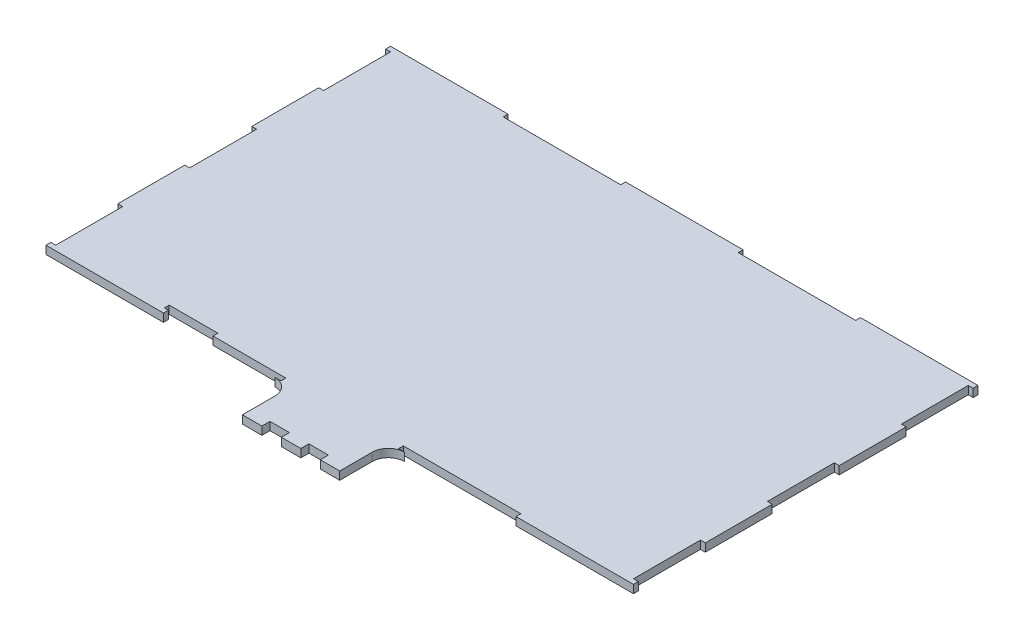
from build123d import *

# Parameters (mm, degrees)
BOSS_EXTRUDE1_DEPTH = 5


with BuildPart() as part:
    # Sketch1 → Boss-Extrude1 (new body)
    with BuildSketch(Plane(origin=(0, 0, 0), x_dir=(1, 0, 0), z_dir=(0, 1, 0))):
        with BuildLine():
            Line((-30.000015974, -136.250310986), (-18.000015974, -136.250310986))
            Line((-18.000015974, -136.250310986), (-18.000015974, -131.250310986))
            Line((-18.000015974, -131.250310986), (-6.000015974, -131.250310986))
            Line((-6.000015974, -131.250310986), (-6.000015974, -136.250310986))
            Line((-6.000015974, -136.250310986), (5.999984026, -136.250310986))
            Line((5.999984026, -136.250310986), (5.999984026, -131.250310986))
            Line((5.999984026, -131.250310986), (17.999984026, -131.250310986))
            Line((17.999984026, -131.250310986), (17.999984026, -136.250310986))
            Line((17.999984026, -136.250310986), (30.000006721, -136.250310986))
            Line((30.000006721, -136.250310986), (30.000006721, -116.24999063))
            ThreePointArc((30.000006721, -116.24999063), (32.92893891, -109.178922818), (40.000006721, -106.24999063))
            Line((40.000006721, -106.24999063), (36.229984025, -106.24999063))
            Line((36.229984025, -106.24999063), (36.229984025, -103.249670275))
            Line((36.229984025, -103.249670275), (108.689984025, -103.249670275))
            Line((108.689984025, -103.249670275), (108.689984025, -106.24999063))
            Line((108.689984025, -106.24999063), (181.149984025, -106.24999063))
            Line((181.149984025, -106.24999063), (181.149984025, -103.24999063))
            Line((181.149984025, -103.24999063), (178.149984476, -103.24999063))
            Line((178.149984476, -103.24999063), (178.149984476, -61.94999063))
            Line((178.149984476, -61.94999063), (181.149984025, -61.94999063))
            Line((181.149984025, -61.94999063), (181.149984025, -20.64999063))
            Line((181.149984025, -20.64999063), (178.149984927, -20.64999063))
            Line((178.149984927, -20.64999063), (178.149984927, 20.65000937))
            Line((178.149984927, 20.65000937), (181.149984025, 20.65000937))
            Line((181.149984025, 20.65000937), (181.149984025, 61.95000937))
            Line((181.149984025, 61.95000937), (178.149984927, 61.95000937))
            Line((178.149984927, 61.95000937), (178.149984927, 103.25000937))
            Line((178.149984927, 103.25000937), (181.149984025, 103.25000937))
            Line((181.149984025, 103.25000937), (181.150047924, 106.25000937))
            Line((181.150047924, 106.25000937), (108.689984025, 106.25000937))
            Line((108.689984025, 106.25000937), (108.689984025, 103.249689014))
            Line((108.689984025, 103.249689014), (36.229984025, 103.249689014))
            Line((36.229984025, 103.249689014), (36.229984025, 106.25000937))
            Line((36.229984025, 106.25000937), (-36.230015974, 106.25000937))
            Line((-36.230015974, 106.25000937), (-36.230015974, 103.249689014))
            Line((-36.230015974, 103.249689014), (-108.690015974, 103.249689014))
            Line((-108.690015974, 103.249689014), (-108.690015974, 106.25000937))
            Line((-108.690015974, 106.25000937), (-181.150015974, 106.25000937))
            Line((-181.150015974, 106.25000937), (-181.150015974, 103.25000937))
            Line((-181.150015974, 103.25000937), (-178.150016876, 103.25000937))
            Line((-178.150016876, 103.25000937), (-178.150016876, 61.95000937))
            Line((-178.150016876, 61.95000937), (-181.150015974, 61.95000937))
            Line((-181.150015974, 61.95000937), (-181.150015974, 20.65000937))
            Line((-181.150015974, 20.65000937), (-178.150016876, 20.65000937))
            Line((-178.150016876, 20.65000937), (-178.150016876, -20.64999063))
            Line((-178.150016876, -20.64999063), (-181.150015974, -20.64999063))
            Line((-181.150015974, -20.64999063), (-181.150015974, -61.94999063))
            Line((-181.150015974, -61.94999063), (-178.150016425, -61.94999063))
            Line((-178.150016425, -61.94999063), (-178.150016425, -103.24999063))
            Line((-178.150016425, -103.24999063), (-181.150015974, -103.24999063))
            Line((-181.150015974, -103.24999063), (-181.150015974, -106.24999063))
            Line((-181.150015974, -106.24999063), (-108.690015974, -106.24999063))
            Line((-108.690015974, -106.24999063), (-108.690015974, -103.24999063))
            Line((-108.690015974, -103.24999063), (-111.150015974, -103.24999063))
            Line((-111.150015974, -103.24999063), (-111.150015974, -100.24999063))
            Line((-111.150015974, -100.24999063), (-81.150015974, -100.24999063))
            Line((-81.150015974, -100.24999063), (-81.150015974, -103.249670275))
            Line((-81.150015974, -103.249670275), (-36.230015974, -103.249670275))
            Line((-36.230015974, -103.249670275), (-36.230015974, -106.24999063))
            Line((-36.230015974, -106.24999063), (-40.000015974, -106.24999063))
            ThreePointArc((-40.000015974, -106.24999063), (-32.928948162, -109.178922818), (-30.000015974, -116.24999063))
            Line((-30.000015974, -116.24999063), (-30.000015974, -136.250310986))
        make_face()
    extrude(amount=BOSS_EXTRUDE1_DEPTH)


solid = part.part
